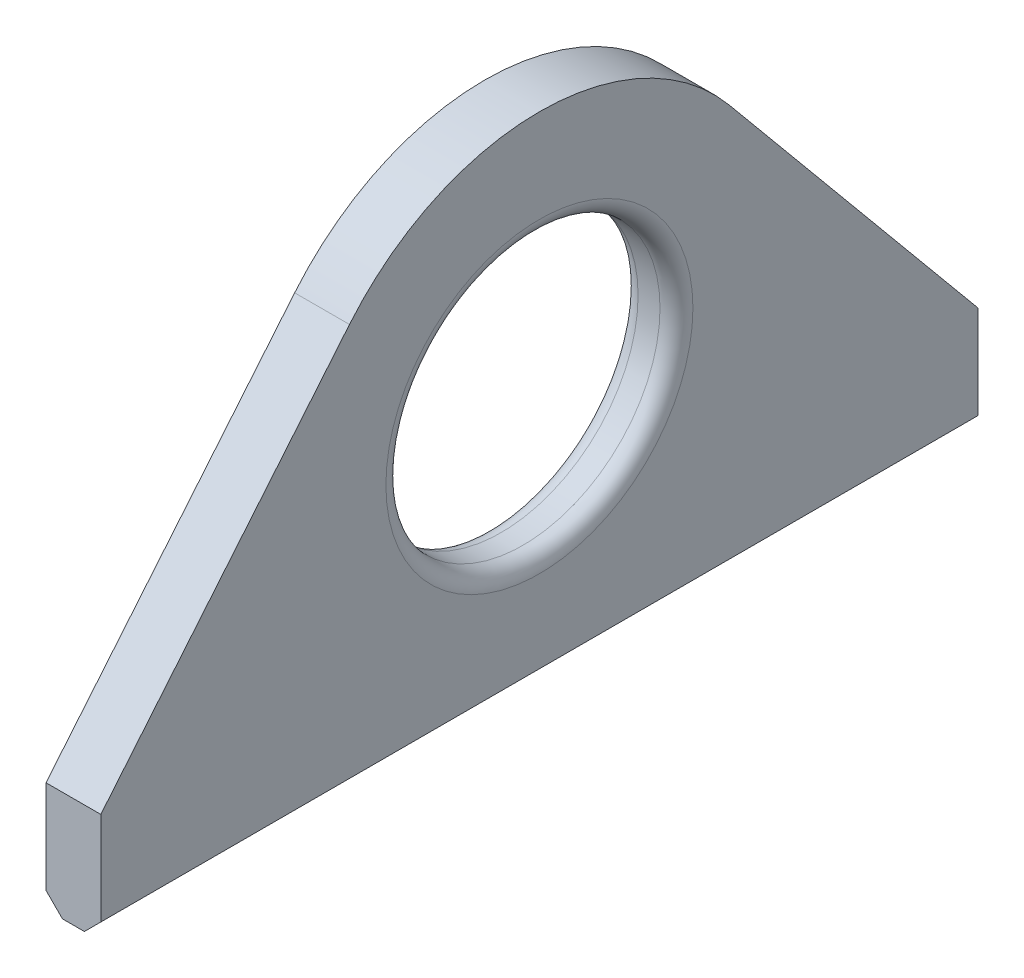
from build123d import *

# Parameters (mm, degrees)
SKETCH1_R          = 25
BASE_FLANGE1_DEPTH = 10
FILLET1_R          = 3
CHAMFER1_SIZE      = 3


# Sheet-metal steps are written as plain solids
with BuildPart() as part:
    # Sketch1 → Base-Flange1 (new body)
    with BuildSketch(Plane(origin=(0, 0, 0), x_dir=(0, 0, -1), z_dir=(1, 0, 0))):
        with BuildLine():
            Line((-80, -46), (80, -46))
            Line((80, -46), (80, -26))
            Line((80, -26), (34.645612429, 28.717269011))
            ThreePointArc((34.645612429, 28.717269011), (0, 45), (-34.645612429, 28.717269011))
            Line((-34.645612429, 28.717269011), (-80, -26))
            Line((-80, -26), (-80, -46))
        make_face()
        Circle(SKETCH1_R, mode=Mode.SUBTRACT)
    extrude(amount=-BASE_FLANGE1_DEPTH)

    # Fillet1
    fillet1_edges = [part.edges().sort_by_distance(p)[0] for p in [
        (-10, 0, 25),
        (0, 0, 25),
    ]]
    fillet(fillet1_edges, radius=FILLET1_R)

    # Chamfer1
    chamfer1_edges = [part.edges().sort_by_distance(p)[0] for p in [
        (-10, -46, 0),
        (0, -46, 0),
    ]]
    chamfer(chamfer1_edges, length=CHAMFER1_SIZE)


solid = part.part
